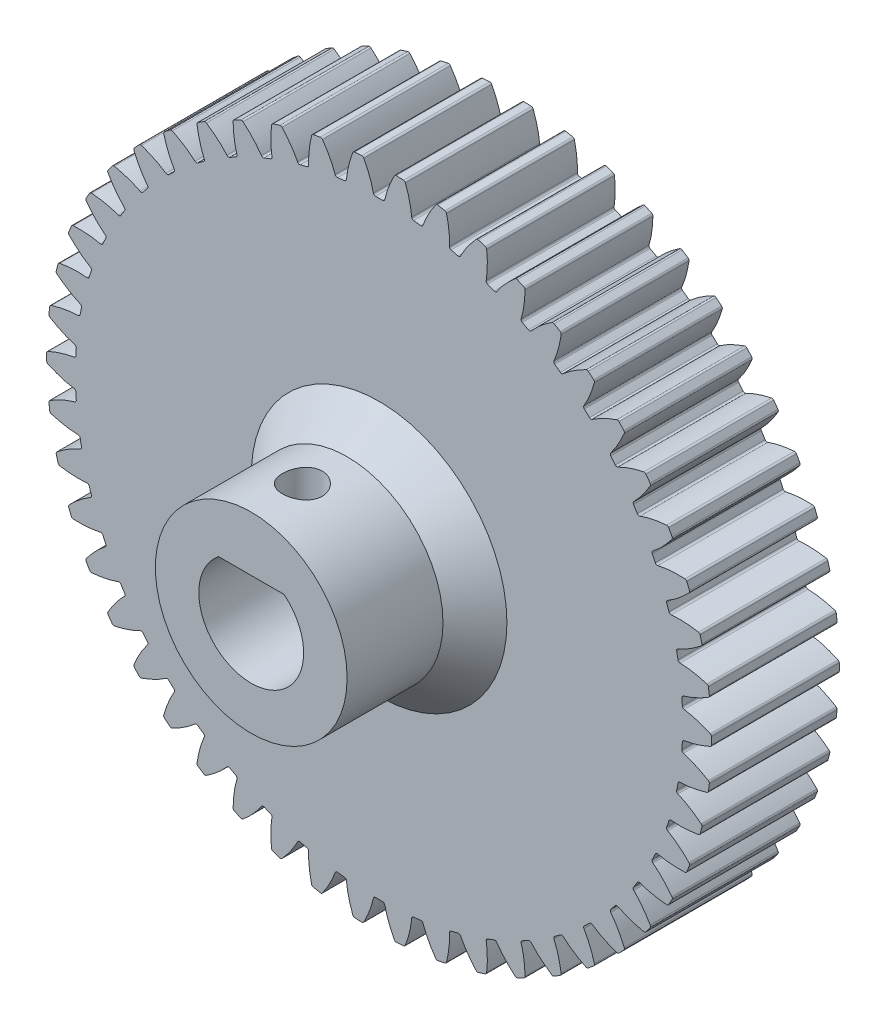
from build123d import *

# Parameters (mm, degrees)
SKETCH1_R                                = 26
BOSS_EXTRUDE1_DEPTH                      = 10
CUT_EXTRUDE_DCGTBC_DEPTH                 = 39.105117767
FILLET_TIP_DCGTBC_R                      = 0.167752518
CIRPATTERN_DCGTBC_COUNT                  = 50
FILLET_TIP_DCGTBC_OF_CIRPATTERN_DCGTBC_R = 0.167752518
CUT_EXTRUDE1_DEPTH                       = 39.081257776
CUT_EXTRUDE1_DEPTH_BACK                  = 39.081257776
BOSS_EXTRUDE3_START                      = 10
SKETCH9_R                                = 7.5
BOSS_EXTRUDE3_DEPTH                      = 10
CHAMFER1_SIZE                            = 2.5
CUT_EXTRUDE2_REACH                       = 48.861
SKETCH10_R                               = 1.55


with BuildPart() as part:
    # Sketch1 → Boss-Extrude1 (new body)
    with BuildSketch(Plane.XY):
        Circle(SKETCH1_R)
    extrude(amount=BOSS_EXTRUDE1_DEPTH)

    # DCGTBC → Cut-Extrude-DCGTBC (cut, through all)
    with BuildSketch(Plane.XY):
        with BuildLine():
            add(Edge.make_bspline(
                [(0.417725427, 23.746326147), (0.418076366, 23.748433493), (0.421710378, 23.770146189), (0.428969855, 23.811407216), (0.440569886, 23.872095787), (0.456933037, 23.949897096), (0.474635834, 24.027451312), (0.493515344, 24.104653171), (0.517856385, 24.198099905), (0.549089819, 24.310051148), (0.588580624, 24.440745712), (0.636891572, 24.588774691), (0.689899356, 24.739415111), (0.745158194, 24.887453315), (0.80455742, 25.036791245), (0.864556814, 25.181116348), (0.930537507, 25.330771231), (0.993301174, 25.468780409), (1.067674289, 25.62310468), (1.128877101, 25.747559728), (1.195484586, 25.87586559), (1.228402606, 25.938274912), (1.245436376, 25.970153797)],
                knots=[0.089169482, 0.089169482, 0.089169482, 0.089169482, 0.089169482, 0.092110526, 0.119476176, 0.146842496, 0.174208854, 0.201574956, 0.228941013, 0.256307345, 0.307035032, 0.361767352, 0.416499661, 0.471231937, 0.525964282, 0.580696616, 0.635428982, 0.690161387, 0.744893688, 0.799626082, 0.854358407, 0.909090914, 0.909090914, 0.909090914, 0.909090914, 0.909090914], degree=4))
            ThreePointArc((1.245436376, 25.970153797), (0, 26), (-1.245436376, 25.970153797))
            add(Edge.make_bspline(
                [(-0.417725427, 23.746326147), (-0.418076366, 23.748433493), (-0.421710378, 23.770146189), (-0.428969855, 23.811407216), (-0.440569886, 23.872095787), (-0.456933037, 23.949897096), (-0.474635834, 24.027451312), (-0.493515344, 24.104653171), (-0.517856385, 24.198099905), (-0.549089819, 24.310051148), (-0.588580624, 24.440745712), (-0.636891572, 24.588774691), (-0.689899356, 24.739415111), (-0.745158194, 24.887453315), (-0.80455742, 25.036791245), (-0.864556814, 25.181116348), (-0.930537507, 25.330771231), (-0.993301174, 25.468780409), (-1.067674289, 25.62310468), (-1.128877101, 25.747559728), (-1.195484586, 25.87586559), (-1.228402606, 25.938274912), (-1.245436376, 25.970153797)],
                knots=[0.089169482, 0.089169482, 0.089169482, 0.089169482, 0.089169482, 0.092110526, 0.119476176, 0.146842496, 0.174208854, 0.201574956, 0.228941013, 0.256307345, 0.307035032, 0.361767352, 0.416499661, 0.471231937, 0.525964282, 0.580696616, 0.635428982, 0.690161387, 0.744893688, 0.799626082, 0.854358407, 0.909090914, 0.909090914, 0.909090914, 0.909090914, 0.909090914], degree=4))
            ThreePointArc((-0.417725427, 23.746326147), (0, 23.75), (0.417725427, 23.746326147))
        make_face()
    cut_extrude_dcgtbc = extrude(amount=CUT_EXTRUDE_DCGTBC_DEPTH, mode=Mode.SUBTRACT)

    # Fillet-Tip-DCGTBC
    fillet_tip_dcgtbc_edges = [part.edges().sort_by_distance(p)[0] for p in [
        (1.245436376, 25.970153797, 5),
        (-1.245436376, 25.970153797, 5),
        (0.417725427, 23.746326147, 5),
        (-0.417725427, 23.746326147, 5),
    ]]
    fillet(fillet_tip_dcgtbc_edges, radius=FILLET_TIP_DCGTBC_R)

    # CirPattern-DCGTBC: Cut-Extrude-DCGTBC ×50 about axis
    cirpattern_dcgtbc_axis = Axis((0, 0, 10), (0, 0, 1))
    for i in range(1, CIRPATTERN_DCGTBC_COUNT):
        add(cut_extrude_dcgtbc.rotate(cirpattern_dcgtbc_axis, i * 360 / CIRPATTERN_DCGTBC_COUNT), mode=Mode.SUBTRACT)

    # Fillet-Tip-DCGTBC of CirPattern-DCGTBC
    fillet_tip_dcgtbc_of_cirpattern_dcgtbc_edges = [part.edges().sort_by_distance(p)[0] for p in [
        (-2.019307613, 25.921465946, 5),
        (-4.49053909, 25.609276809, 5),
        (-2.561772304, 23.611434151, 5),
        (-3.390635378, 23.506724394, 5),
        (-5.252205915, 25.463981091, 5),
        (-7.66482332, 24.844526228, 5),
        (-5.500869356, 23.104175734, 5),
        (-6.310072985, 22.896407555, 5),
        (-8.402273792, 24.604914044, 5),
        (-10.718228707, 23.687962626, 5),
        (-8.353214411, 22.232550663, 5),
        (-9.12999697, 21.925000692, 5),
        (-11.419832792, 23.357812804, 5),
        (-13.602601225, 22.157825704, 5),
        (-11.073824286, 21.010304988, 5),
        (-11.80593545, 20.60782347, 5),
        (-14.257294208, 21.742344903, 5),
        (-16.272452596, 20.278246633, 5),
        (-13.619793336, 19.456714252, 5),
        (-14.295687275, 18.965648561, 5),
        (-16.869909576, 19.783987234, 5),
        (-18.685677668, 18.0788675, 5),
        (-15.950970109, 17.59627951, 5),
        (-16.559987571, 17.024374045, 5),
        (-19.216476393, 17.513624269, 5),
        (-20.804218441, 15.594373826, 5),
        (-18.030590555, 15.458340928, 5),
        (-18.563126972, 14.814614981, 5),
        (-21.259987898, 14.967060986, 5),
        (-22.594664262, 12.863947562, 5),
        (-19.825857817, 13.076615075, 5),
        (-20.27351477, 12.371220589, 5),
        (-22.968216694, 12.184458211, 5),
        (-24.02877873, 9.93064916, 5),
        (-21.308459458, 10.488663191, 5),
        (-21.664177131, 9.732724657, 5),
        (-24.314222992, 9.209699251, 5),
        (-25.083945003, 6.840738488, 5),
        (-22.455013964, 7.735298823, 5),
        (-22.713182476, 6.940737844, 5),
        (-25.276779469, 6.089697833, 5),
        (-25.74352248, 3.642945284, 5),
        (-23.247439486, 4.859944171, 5),
        (-23.403987365, 4.039291449, 5),
        (-25.840706034, 2.873658241, 5),
        (-25.997109228, 0.387700657, 5),
        (-23.673239, 1.907945297, 5),
        (-23.725697393, 1.074143014, 5),
        (-25.997109228, -0.387700657, 5),
        (-25.840706034, -2.873658241, 5),
        (-23.725697393, -1.074143014, 5),
        (-23.673239, -1.907945297, 5),
        (-25.74352248, -3.642945284, 5),
        (-25.276779469, -6.089697833, 5),
        (-23.403987365, -4.039291449, 5),
        (-23.247439486, -4.859944171, 5),
        (-25.083945003, -6.840738488, 5),
        (-24.314222992, -9.209699251, 5),
        (-22.713182476, -6.940737844, 5),
        (-22.455013964, -7.735298823, 5),
        (-24.02877873, -9.93064916, 5),
        (-22.968216694, -12.184458211, 5),
        (-21.664177131, -9.732724657, 5),
        (-21.308459458, -10.488663191, 5),
        (-22.594664262, -12.863947562, 5),
        (-21.259987898, -14.967060986, 5),
        (-20.27351477, -12.371220589, 5),
        (-19.825857817, -13.076615075, 5),
        (-20.804218441, -15.594373826, 5),
        (-19.216476393, -17.513624269, 5),
        (-18.563126972, -14.814614981, 5),
        (-18.030590555, -15.458340928, 5),
        (-18.685677668, -18.0788675, 5),
        (-16.869909576, -19.783987234, 5),
        (-16.559987571, -17.024374045, 5),
        (-15.950970109, -17.59627951, 5),
        (-16.272452596, -20.278246633, 5),
        (-14.257294208, -21.742344903, 5),
        (-14.295687275, -18.965648561, 5),
        (-13.619793336, -19.456714252, 5),
        (-13.602601225, -22.157825704, 5),
        (-11.419832792, -23.357812804, 5),
        (-11.80593545, -20.60782347, 5),
        (-11.073824286, -21.010304988, 5),
        (-10.718228707, -23.687962626, 5),
        (-8.402273792, -24.604914044, 5),
        (-9.12999697, -21.925000692, 5),
        (-8.353214411, -22.232550663, 5),
        (-7.66482332, -24.844526228, 5),
        (-5.252205915, -25.463981091, 5),
        (-6.310072985, -22.896407555, 5),
        (-5.500869356, -23.104175734, 5),
        (-4.49053909, -25.609276809, 5),
        (-2.019307613, -25.921465946, 5),
        (-3.390635378, -23.506724394, 5),
        (-2.561772304, -23.611434151, 5),
        (-1.245436376, -25.970153797, 5),
        (1.245436376, -25.970153797, 5),
        (-0.417725427, -23.746326147, 5),
        (0.417725427, -23.746326147, 5),
        (2.019307613, -25.921465946, 5),
        (4.49053909, -25.609276809, 5),
        (2.561772304, -23.611434151, 5),
        (3.390635378, -23.506724394, 5),
        (5.252205915, -25.463981091, 5),
        (7.66482332, -24.844526228, 5),
        (5.500869356, -23.104175734, 5),
        (6.310072985, -22.896407555, 5),
        (8.402273792, -24.604914044, 5),
        (10.718228707, -23.687962626, 5),
        (8.353214411, -22.232550663, 5),
        (9.12999697, -21.925000692, 5),
        (11.419832792, -23.357812804, 5),
        (13.602601225, -22.157825704, 5),
        (11.073824286, -21.010304988, 5),
        (11.80593545, -20.60782347, 5),
        (14.257294208, -21.742344903, 5),
        (16.272452596, -20.278246633, 5),
        (13.619793336, -19.456714252, 5),
        (14.295687275, -18.965648561, 5),
        (16.869909576, -19.783987234, 5),
        (18.685677668, -18.0788675, 5),
        (15.950970109, -17.59627951, 5),
        (16.559987571, -17.024374045, 5),
        (19.216476393, -17.513624269, 5),
        (20.804218441, -15.594373826, 5),
        (18.030590555, -15.458340928, 5),
        (18.563126972, -14.814614981, 5),
        (21.259987898, -14.967060986, 5),
        (22.594664262, -12.863947562, 5),
        (19.825857817, -13.076615075, 5),
        (20.27351477, -12.371220589, 5),
        (22.968216694, -12.184458211, 5),
        (24.02877873, -9.93064916, 5),
        (21.308459458, -10.488663191, 5),
        (21.664177131, -9.732724657, 5),
        (24.314222992, -9.209699251, 5),
        (25.083945003, -6.840738488, 5),
        (22.455013964, -7.735298823, 5),
        (22.713182476, -6.940737844, 5),
        (25.276779469, -6.089697833, 5),
        (25.74352248, -3.642945284, 5),
        (23.247439486, -4.859944171, 5),
        (23.403987365, -4.039291449, 5),
        (25.840706034, -2.873658241, 5),
        (25.997109228, -0.387700657, 5),
        (23.673239, -1.907945297, 5),
        (23.725697393, -1.074143014, 5),
        (25.997109228, 0.387700657, 5),
        (25.840706034, 2.873658241, 5),
        (23.725697393, 1.074143014, 5),
        (23.673239, 1.907945297, 5),
        (25.74352248, 3.642945284, 5),
        (25.276779469, 6.089697833, 5),
        (23.403987365, 4.039291449, 5),
        (23.247439486, 4.859944171, 5),
        (25.083945003, 6.840738488, 5),
        (24.314222992, 9.209699251, 5),
        (22.713182476, 6.940737844, 5),
        (22.455013964, 7.735298823, 5),
        (24.02877873, 9.93064916, 5),
        (22.968216694, 12.184458211, 5),
        (21.664177131, 9.732724657, 5),
        (21.308459458, 10.488663191, 5),
        (22.594664262, 12.863947562, 5),
        (21.259987898, 14.967060986, 5),
        (20.27351477, 12.371220589, 5),
        (19.825857817, 13.076615075, 5),
        (20.804218441, 15.594373826, 5),
        (19.216476393, 17.513624269, 5),
        (18.563126972, 14.814614981, 5),
        (18.030590555, 15.458340928, 5),
        (18.685677668, 18.0788675, 5),
        (16.869909576, 19.783987234, 5),
        (16.559987571, 17.024374045, 5),
        (15.950970109, 17.59627951, 5),
        (16.272452596, 20.278246633, 5),
        (14.257294208, 21.742344903, 5),
        (14.295687275, 18.965648561, 5),
        (13.619793336, 19.456714252, 5),
        (13.602601225, 22.157825704, 5),
        (11.419832792, 23.357812804, 5),
        (11.80593545, 20.60782347, 5),
        (11.073824286, 21.010304988, 5),
        (10.718228707, 23.687962626, 5),
        (8.402273792, 24.604914044, 5),
        (9.12999697, 21.925000692, 5),
        (8.353214411, 22.232550663, 5),
        (7.66482332, 24.844526228, 5),
        (5.252205915, 25.463981091, 5),
        (6.310072985, 22.896407555, 5),
        (5.500869356, 23.104175734, 5),
        (4.49053909, 25.609276809, 5),
        (2.019307613, 25.921465946, 5),
        (3.390635378, 23.506724394, 5),
        (2.561772304, 23.611434151, 5),
    ]]
    fillet(fillet_tip_dcgtbc_of_cirpattern_dcgtbc_edges, radius=FILLET_TIP_DCGTBC_OF_CIRPATTERN_DCGTBC_R)

    # Sketch6 → Cut-Extrude1 (cut, two sides: drawn at the far end of the back side and taken through both)
    with BuildSketch(Plane(origin=(0, 0, 0), x_dir=(-1, 0, 0), z_dir=(0, 0, -1)).offset(-CUT_EXTRUDE1_DEPTH_BACK)):
        with BuildLine():
            Line((-2.562701668, 3.2004), (2.562701668, 3.2004))
            ThreePointArc((2.562701668, 3.2004), (0, -4.1), (-2.562701668, 3.2004))
        make_face()
    extrude(amount=CUT_EXTRUDE1_DEPTH + CUT_EXTRUDE1_DEPTH_BACK, mode=Mode.SUBTRACT)

    # Sketch9 → Boss-Extrude3 (add)
    with BuildSketch(Plane.XY.offset(10).offset(BOSS_EXTRUDE3_START)):
        Circle(SKETCH9_R)
        with BuildLine():
            Line((-2.562701668, 3.2004), (2.562701668, 3.2004))
            ThreePointArc((2.562701668, 3.2004), (0, -4.1), (-2.562701668, 3.2004))
        make_face(mode=Mode.SUBTRACT)
    extrude(amount=-BOSS_EXTRUDE3_DEPTH)

    # Chamfer1
    chamfer1_edges = [part.edges().sort_by_distance(p)[0] for p in [
        (-7.5, 0, 10),
    ]]
    chamfer(chamfer1_edges, length=CHAMFER1_SIZE)

    # Sketch10 → Cut-Extrude2 (cut, up to next)
    with BuildSketch(Plane(origin=(0, 7.5, 0), x_dir=(1, 0, 0), z_dir=(0, 1, 0)), mode=Mode.PRIVATE) as cut_extrude2_sk1:
        with Locations(Location((0, -16, 0), (0, 0, 270))):
            Circle(SKETCH10_R)
    cut_extrude2_tool1 = extrude(cut_extrude2_sk1.sketch, amount=-CUT_EXTRUDE2_REACH, mode=Mode.PRIVATE) & part.part
    add(cut_extrude2_tool1.solids().sort_by_distance((0, 7.5, 16))[0], mode=Mode.SUBTRACT)


solid = part.part
